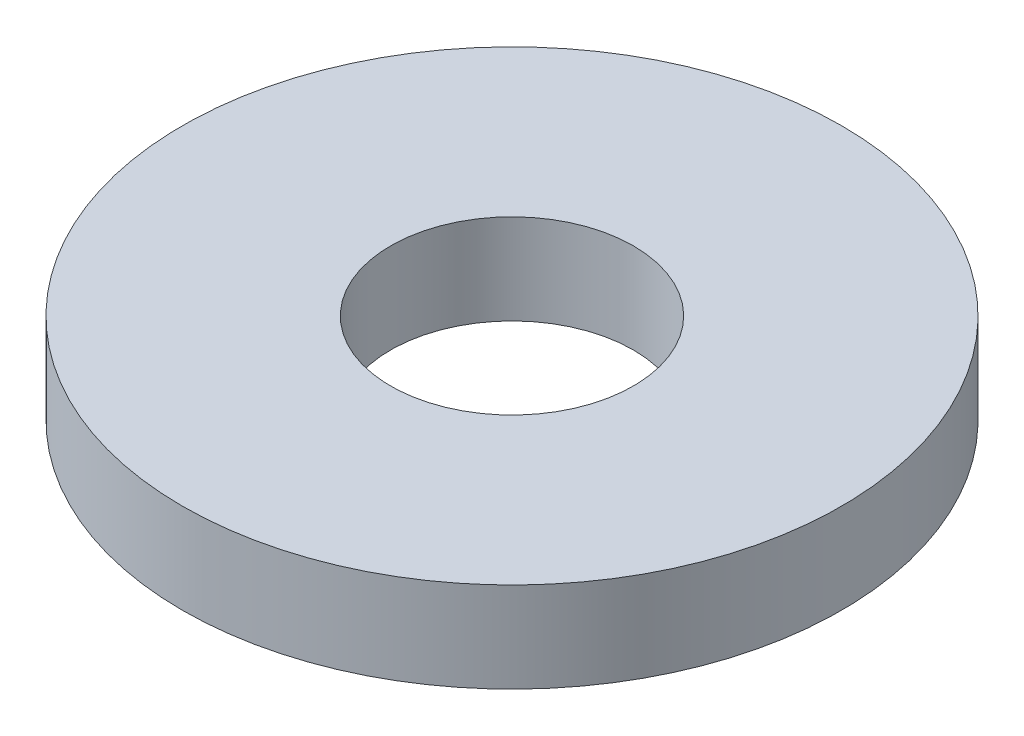
from build123d import *

# Parameters (mm, degrees)
SKETCH1_R           = 95
BOSS_EXTRUDE1_DEPTH = 26
SKETCH2_R           = 35
CUT_EXTRUDE1_DEPTH  = 137.842975706


with BuildPart() as part:
    # Sketch1 → Boss-Extrude1 (new body)
    with BuildSketch(Plane(origin=(0, 0, 0), x_dir=(1, 0, 0), z_dir=(0, 1, 0))):
        Circle(SKETCH1_R)
    extrude(amount=BOSS_EXTRUDE1_DEPTH)

    # Sketch2 → Cut-Extrude1 (cut, through all)
    with BuildSketch(Plane(origin=(0, 0, 0), x_dir=(1, 0, 0), z_dir=(0, 1, 0))):
        Circle(SKETCH2_R)
    extrude(amount=CUT_EXTRUDE1_DEPTH, mode=Mode.SUBTRACT)


solid = part.part
